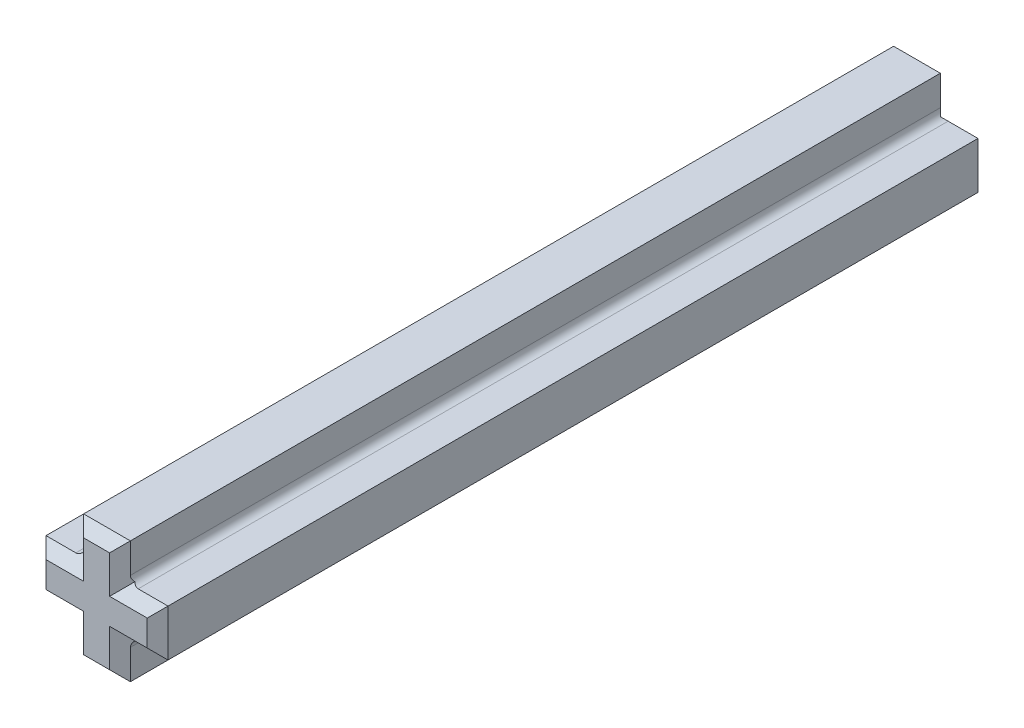
from build123d import *

# Parameters (mm, degrees)
BOSS_EXTRUDE1_DEPTH = 16
CHAMFER1_SIZE       = 0.4
FILLET1_R           = 0.3


with BuildPart() as part:
    # Sketch1 → Boss-Extrude1 (new, symmetric)
    with BuildSketch(Plane.XY):
        Polygon((0.9, -0.9), (0.9, -2.35), (-0.9, -2.35), (-0.9, -0.9), (-2.35, -0.9), (-2.35, 0.9), (-0.9, 0.9), (-0.9, 2.35), (0.9, 2.35), (0.9, 0.9), (2.35, 0.9), (2.35, -0.9), align=None)
    extrude(amount=BOSS_EXTRUDE1_DEPTH, both=True)

    # Chamfer1
    chamfer1_edges = [part.edges().sort_by_distance(p)[0] for p in [
        (2.35, 0, -16),
        (1.625, 0.9, -16),
        (0.9, 1.625, -16),
        (0, 2.35, -16),
        (-0.9, 1.625, -16),
        (-1.625, 0.9, -16),
        (-2.35, 0, -16),
        (-1.625, -0.9, -16),
        (-0.9, -1.625, -16),
        (0, -2.35, -16),
        (0.9, -1.625, -16),
        (1.625, -0.9, -16),
        (0.9, -1.625, 16),
        (0, -2.35, 16),
        (-0.9, -1.625, 16),
        (-1.625, -0.9, 16),
        (-2.35, 0, 16),
        (-1.625, 0.9, 16),
        (-0.9, 1.625, 16),
        (0, 2.35, 16),
        (0.9, 1.625, 16),
        (1.625, 0.9, 16),
        (2.35, 0, 16),
        (1.625, -0.9, 16),
    ]]
    chamfer(chamfer1_edges, length=CHAMFER1_SIZE)

    # Fillet1
    fillet1_edges = [part.edges().sort_by_distance(p)[0] for p in [
        (-0.9, -0.9, 0),
        (-0.9, 0.9, 0),
        (0.9, -0.9, 0),
        (0.9, 0.9, 0),
    ]]
    fillet(fillet1_edges, radius=FILLET1_R)


solid = part.part
